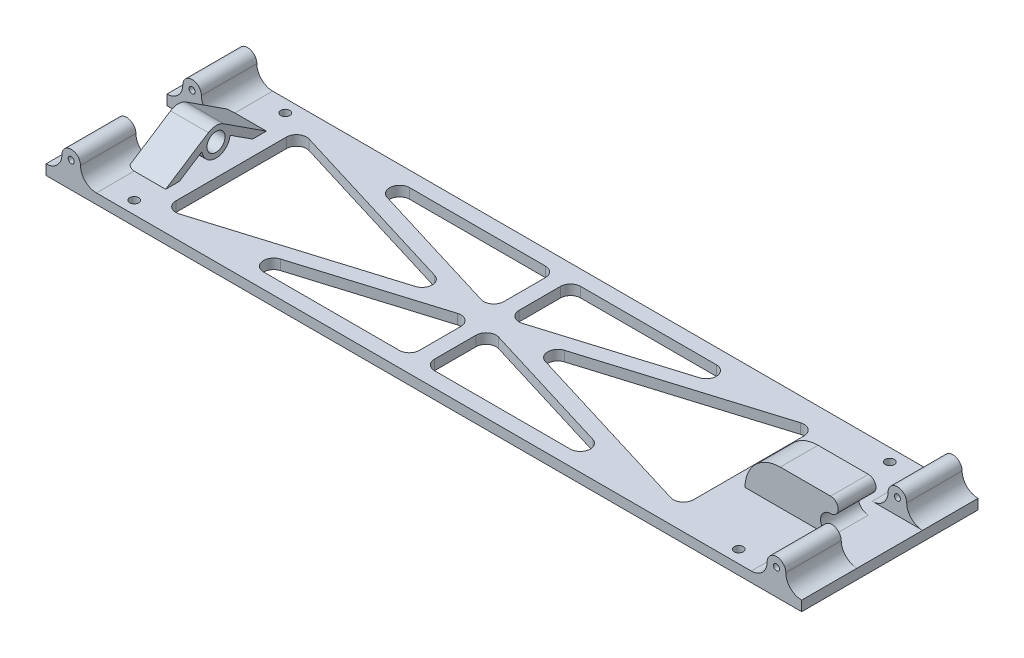
from build123d import *

# Parameters (mm, degrees)
SKETCH1_R                    = 1.2
BOSS_EXTRUDE1_DEPTH          = 35
SKETCH2_W                    = 26
SKETCH2_H                    = 10
CUT_EXTRUDE1_DEPTH           = 303.359058075
BOSS_EXTRUDE2_DEPTH          = 7.5
SKETCH4_W                    = 20
SKETCH4_H                    = 26
CUT_EXTRUDE2_DEPTH           = 303.359058075
BOSS_EXTRUDE3_START          = 17.5
SKETCH6_R                    = 3.6
BOSS_EXTRUDE3_DEPTH          = 15
M3_CLEARANCE_HOLE1_OUTLINE_R = 1.8
M3_CLEARANCE_HOLE1_DEPTH     = 4
CUT_EXTRUDE7_DEPTH           = 303.359058075
FILLET8_R                    = 4


# Read off the part's stored shape, not the designer's step: M3 Clearance Hole1
with BuildPart() as part:
    # Sketch1 → Boss-Extrude1 (new, symmetric)
    with BuildSketch(Plane.XY):
        with BuildLine():
            Line((0, 0), (300, 0))
            Line((300, 0), (300, 4))
            ThreePointArc((300, 4), (295.545227279, 5.845227279), (293.7, 10.3))
            ThreePointArc((293.7, 10.3), (290, 14), (286.3, 10.3))
            ThreePointArc((286.3, 10.3), (284.454772721, 5.845227279), (280, 4))
            Line((280, 4), (20, 4))
            ThreePointArc((20, 4), (15.545227279, 5.845227279), (13.7, 10.3))
            ThreePointArc((13.7, 10.3), (10, 14), (6.3, 10.3))
            ThreePointArc((6.3, 10.3), (4.454772721, 5.845227279), (0, 4))
            Line((0, 4), (0, 0))
        make_face()
        with Locations((10, 10.3)):
            Circle(SKETCH1_R, mode=Mode.SUBTRACT)
        with Locations((290, 10.3)):
            Circle(SKETCH1_R, mode=Mode.SUBTRACT)
    extrude(amount=BOSS_EXTRUDE1_DEPTH, both=True)

    # Sketch2 → Cut-Extrude1 (cut, through all)
    with BuildSketch(Plane(origin=(0, 0, 0), x_dir=(0, 0, -1), z_dir=(1, 0, 0))):
        with Locations((0, 9)):
            Rectangle(SKETCH2_W, SKETCH2_H)
    extrude(amount=CUT_EXTRUDE1_DEPTH, mode=Mode.SUBTRACT)

    # Sketch3 → Boss-Extrude2 (add, symmetric)
    with BuildSketch(Plane.XY):
        with BuildLine():
            Line((284, 18), (264, 18))
            ThreePointArc((264, 18), (254.100505063, 13.899494937), (250, 4))
            Line((250, 4), (284, 4))
            ThreePointArc((284, 4), (280, 8), (284, 12))
            ThreePointArc((284, 12), (287, 15), (284, 18))
        make_face()
    extrude(amount=BOSS_EXTRUDE2_DEPTH, both=True)

    # Sketch4 → Cut-Extrude2 (cut, through all)
    with BuildSketch(Plane(origin=(0, 4, 0), x_dir=(1, 0, 0), z_dir=(0, 1, 0))):
        with Locations((10, 0)):
            Rectangle(SKETCH4_W, SKETCH4_H)
    extrude(amount=-CUT_EXTRUDE2_DEPTH, mode=Mode.SUBTRACT)

    # Sketch6 → Boss-Extrude3 (add)
    with BuildSketch(Plane(origin=(0, 0, 0), x_dir=(0, 0, -1), z_dir=(1, 0, 0)).offset(BOSS_EXTRUDE3_START)):
        with BuildLine():
            Line((-14.487917861, 4), (-5.57596765, 9.781748355))
            ThreePointArc((-5.57596765, 9.781748355), (0, 4.7), (5.57596765, 9.781748355))
            Line((5.57596765, 9.781748355), (14.487917861, 4))
            Line((14.487917861, 4), (20, 4))
            Line((20, 4), (3.047850082, 14.997936768))
            ThreePointArc((3.047850082, 14.997936768), (0, 15.9), (-3.047850082, 14.997936768))
            Line((-3.047850082, 14.997936768), (-20, 4))
            Line((-20, 4), (-14.487917861, 4))
        make_face()
        with Locations((0, 10.3)):
            Circle(SKETCH6_R, mode=Mode.SUBTRACT)
    extrude(amount=BOSS_EXTRUDE3_DEPTH)

    # M3 Clearance Hole1 outline → M3 Clearance Hole1 (cut)
    with BuildSketch(Plane(origin=(0, 0, 0), x_dir=(1, 0, 0), z_dir=(0, 1, 0))):
        with Locations((30, -30)):
            Circle(M3_CLEARANCE_HOLE1_OUTLINE_R)
        with Locations((270, 30)):
            Circle(M3_CLEARANCE_HOLE1_OUTLINE_R)
        with Locations((270, -30)):
            Circle(M3_CLEARANCE_HOLE1_OUTLINE_R)
        with Locations((30, 30)):
            Circle(M3_CLEARANCE_HOLE1_OUTLINE_R)
    extrude(amount=M3_CLEARANCE_HOLE1_DEPTH, mode=Mode.SUBTRACT)

    # Sketch12 → Cut-Extrude7 (cut, through all)
    with BuildSketch(Plane(origin=(0, 4, 0), x_dir=(1, 0, 0), z_dir=(0, 1, 0))):
        Polygon((53.630917429, -29), (138.25, -29), (138.25, -3.136996028), align=None)
        Polygon((38.5, -27.350626478), (127.986315, 0), (38.5, 27.350626478), align=None)
        Polygon((138.25, 3.136996028), (138.25, 29), (53.630917429, 29), align=None)
        Polygon((144.25, 29), (144.25, 3.136996028), (228.869082571, 29), align=None)
        Polygon((154.513685, 0), (244, -27.350626478), (244, 27.350626478), align=None)
        Polygon((144.25, -29), (228.869082571, -29), (144.25, -3.136996028), align=None)
    extrude(amount=-CUT_EXTRUDE7_DEPTH, mode=Mode.SUBTRACT)

    # Fillet8
    fillet8_edges = [part.edges().sort_by_distance(p)[0] for p in [
        (53.630917429, 2, -29),
        (138.25, 2, -29),
        (138.25, 2, -3.136996028),
        (38.5, 2, 27.350626478),
        (38.5, 2, -27.350626478),
        (127.986315, 2, 0),
        (244, 2, 27.350626478),
        (154.513685, 2, 0),
        (244, 2, -27.350626478),
        (144.25, 2, -29),
        (228.869082571, 2, -29),
        (144.25, 2, -3.136996028),
        (144.25, 2, 29),
        (144.25, 2, 3.136996028),
        (228.869082571, 2, 29),
        (53.630917429, 2, 29),
        (138.25, 2, 3.136996028),
        (138.25, 2, 29),
    ]]
    fillet(fillet8_edges, radius=FILLET8_R)


solid = part.part
